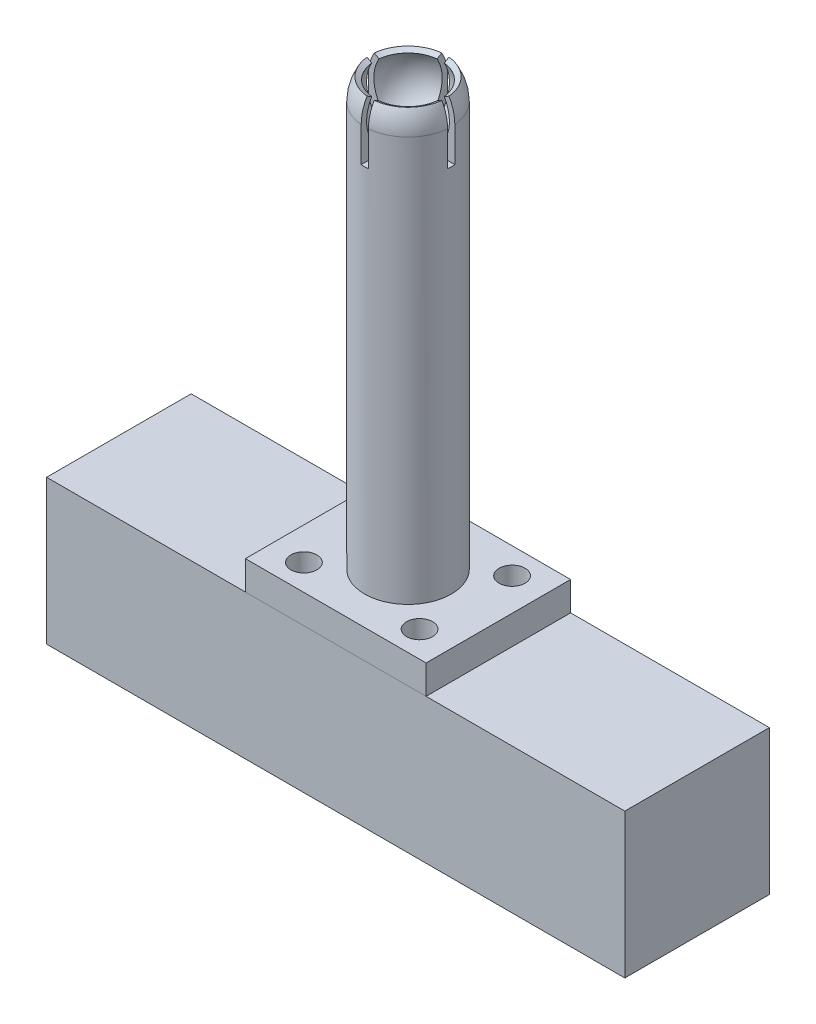
from build123d import *
from build123d.topology import SkipClean

# Parameters (mm, degrees)
SKETCH1_W           = 101.6
SKETCH1_H           = 25.4
BOSS_EXTRUDE1_DEPTH = 25.4
SKETCH2_W           = 31.75
SKETCH2_H           = 25.4
SKETCH2_R           = 2.286
BOSS_EXTRUDE2_DEPTH = 5.08
SKETCH3_R           = 7.62
BOSS_EXTRUDE3_DEPTH = 63.5
CUT_EXTRUDE2_DEPTH  = 9.906


with BuildPart() as part:
    # Sketch1 → Boss-Extrude1 (new body)
    with BuildSketch(Plane(origin=(0, 0, 0), x_dir=(1, 0, 0), z_dir=(0, 1, 0))):
        Rectangle(SKETCH1_W, SKETCH1_H)
    extrude(amount=BOSS_EXTRUDE1_DEPTH)


with BuildPart() as body_2:
    # Sketch2 → Boss-Extrude2 (new body)
    with BuildSketch(Plane(origin=(0, 25.4, 0), x_dir=(1, 0, 0), z_dir=(0, 1, 0))):
        Rectangle(SKETCH2_W, SKETCH2_H)
        with Locations((10.16, -8.128)):
            Circle(SKETCH2_R, mode=Mode.SUBTRACT)
        with Locations((-10.16, -8.128)):
            Circle(SKETCH2_R, mode=Mode.SUBTRACT)
        with Locations((-10.16, 8.128)):
            Circle(SKETCH2_R, mode=Mode.SUBTRACT)
        with Locations((10.16, 8.128)):
            Circle(SKETCH2_R, mode=Mode.SUBTRACT)
    extrude(amount=BOSS_EXTRUDE2_DEPTH)

    # Sketch3 → Boss-Extrude3 (add)
    with BuildSketch(Plane(origin=(0, 30.48, 0), x_dir=(1, 0, 0), z_dir=(0, 1, 0))):
        Circle(SKETCH3_R)
    extrude(amount=BOSS_EXTRUDE3_DEPTH)

    # Sketch4 → Revolve1 (revolve)
    with SkipClean():  # the faces are left unmerged after this step: merging them gives an invalid solid
        with BuildSketch(Plane.XY):
            with BuildLine():
                Line((-7.62, 93.98), (0, 93.98))
                Line((0, 93.98), (0, 94.9325))
                ThreePointArc((0, 94.9325), (-5.77422438, 98.26625), (-5.77422438, 104.93375))
                Line((-5.77422438, 104.93375), (-6.599113577, 105.41))
                ThreePointArc((-6.599113577, 105.41), (-7.360354796, 103.572201124), (-7.62, 101.6))
                Line((-7.62, 101.6), (-7.62, 93.98))
            make_face()
        revolve(axis=Axis((0, 93.98, 0), (0, -1, 0)))
    add(body_2.part.scale(1), mode=Mode.REPLACE)  # the faces are merged on a copy

    # Sketch5 → Cut-Extrude2 (cut)
    with BuildSketch(Plane(origin=(0, 105.41, 0), x_dir=(1, 0, 0), z_dir=(0, 1, 0))):
        Polygon((0.635, -0.635), (8.89, -0.635), (8.89, 0.635), (0.635, 0.635), (0.635, 8.89), (-0.635, 8.89), (-0.635, 0.635), (-8.89, 0.635), (-8.89, -0.635), (-0.635, -0.635), (-0.635, -8.89), (0.635, -8.89), align=None)
    extrude(amount=-CUT_EXTRUDE2_DEPTH, mode=Mode.SUBTRACT)


solid = Compound([part.part, body_2.part])
